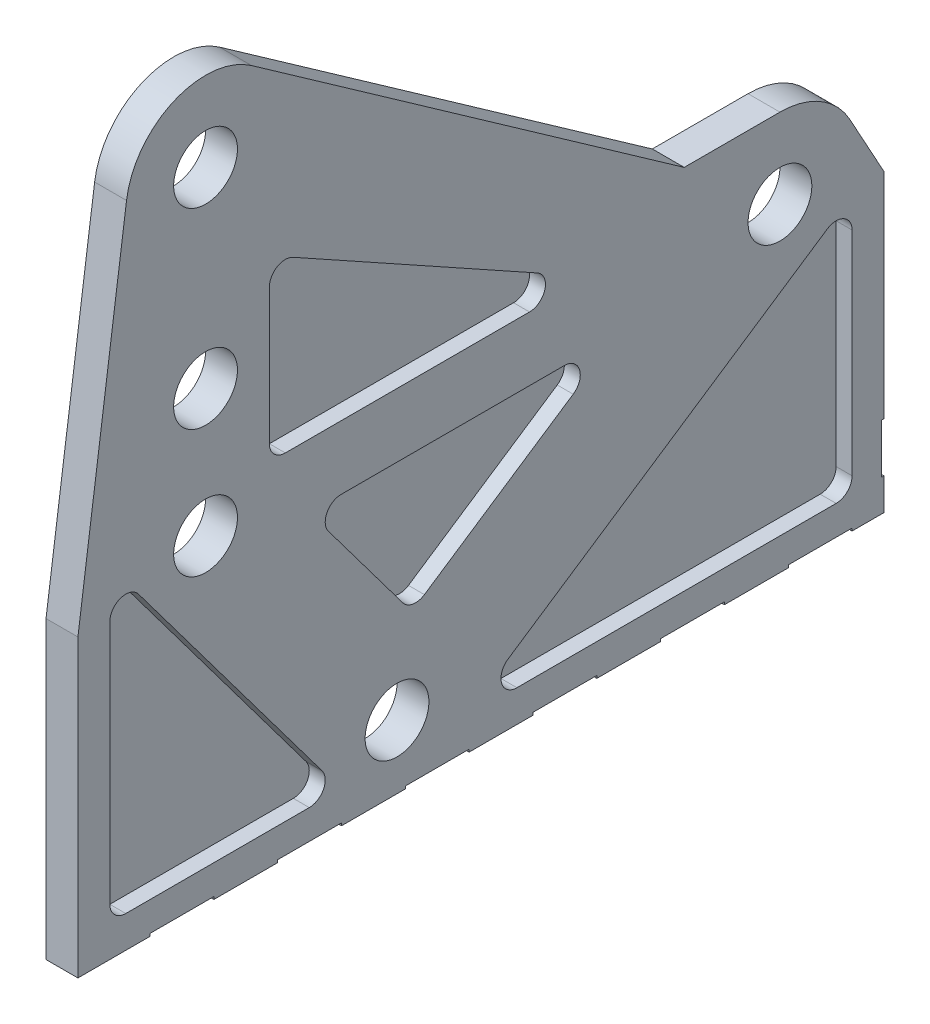
from build123d import *

# Parameters (mm, degrees)
SKETCH1_W           = 558.8
SKETCH1_H           = 88.9
BOSS_EXTRUDE1_DEPTH = 12.7
SKETCH2_R           = 12.7
BOSS_EXTRUDE2_DEPTH = 12.7
BOSS_EXTRUDE3_DEPTH = 12.7
CUT_EXTRUDE1_DEPTH  = 339.909706081
CUT_EXTRUDE2_DEPTH  = 339.909706081
SKETCH6_R           = 12.7
BOSS_EXTRUDE4_DEPTH = 12.7
SKETCH7_R           = 12.7
CUT_EXTRUDE3_DEPTH  = 351.575213043
CUT_EXTRUDE4_DEPTH  = 6.35
SKETCH9_W           = 25.4
SKETCH9_H           = 1.016
CUT_EXTRUDE5_DEPTH  = 351.575213043
SKETCH10_W          = 1.016
SKETCH10_H          = 19.685
CUT_EXTRUDE6_DEPTH  = 351.575213043


with BuildPart() as part:
    # Sketch1 → Boss-Extrude1 (new body)
    with BuildSketch(Plane(origin=(0, 0, 0), x_dir=(0, 0, -1), z_dir=(1, 0, 0))):
        Rectangle(SKETCH1_W, SKETCH1_H)
    extrude(amount=BOSS_EXTRUDE1_DEPTH)

    # Sketch2 → Boss-Extrude2 (add)
    with BuildSketch(Plane(origin=(12.7, 0, 0), x_dir=(0, 0, -1), z_dir=(1, 0, 0))):
        with BuildLine():
            Line((-226.959477075, 103.610620816), (-279.4, 44.45))
            Line((-279.4, 44.45), (82.55, 44.45))
            Line((82.55, 44.45), (53.228733422, 97.8347668))
            ThreePointArc((53.228733422, 97.8347668), (41.567423328, 109.875389713), (25.4, 114.3))
            Line((25.4, 114.3), (-203.2, 114.3))
            ThreePointArc((-203.2, 114.3), (-216.226660913, 111.504595584), (-226.959477075, 103.610620816))
        make_face()
        with Locations((-203.2, 82.55)):
            Circle(SKETCH2_R, mode=Mode.SUBTRACT)
        with Locations((25.4, 82.55)):
            Circle(SKETCH2_R, mode=Mode.SUBTRACT)
    extrude(amount=-BOSS_EXTRUDE2_DEPTH)

    # Sketch3 → Boss-Extrude3 (add)
    with BuildSketch(Plane(origin=(12.7, 0, 0), x_dir=(0, 0, -1), z_dir=(1, 0, 0))):
        Polygon((-279.4, -44.45), (-318.800892213, 0), (-279.4, 44.45), align=None)
    extrude(amount=-BOSS_EXTRUDE3_DEPTH)

    # Sketch4 → Cut-Extrude1 (cut, through all)
    with BuildSketch(Plane(origin=(12.7, 0, 0), x_dir=(0, 0, -1), z_dir=(1, 0, 0))):
        Polygon((82.55, 44.45), (106.963898899, 0), (82.55, -44.45), (279.4, -44.45), (279.4, 44.45), align=None)
    extrude(amount=-CUT_EXTRUDE1_DEPTH, mode=Mode.SUBTRACT)

    # Sketch5 → Cut-Extrude2 (cut, through all)
    with BuildSketch(Plane(origin=(12.7, 0, 0), x_dir=(0, 0, -1), z_dir=(1, 0, 0))):
        Polygon((-254, -44.45), (-254, 73.104934865), (-318.800892213, 0), (-279.4, -44.45), align=None)
        Polygon((66.811446957, 73.104934865), (66.811446957, -44.45), (82.55, -44.45), (106.963898899, 0), align=None)
    extrude(amount=-CUT_EXTRUDE2_DEPTH, mode=Mode.SUBTRACT)

    # Sketch6 → Boss-Extrude4 (add)
    with BuildSketch(Plane(origin=(12.7, 0, 0), x_dir=(0, 0, -1), z_dir=(1, 0, 0))):
        with BuildLine():
            Line((-234.654352451, 213.872755125), (-254, 73.104934865))
            Line((-254, 73.104934865), (-226.959477075, 103.610620816))
            ThreePointArc((-226.959477075, 103.610620816), (-216.226660913, 111.504595584), (-203.2, 114.3))
            Line((-203.2, 114.3), (-12.7, 114.3))
            Line((-12.7, 114.3), (-184.926288387, 235.514089892))
            ThreePointArc((-184.926288387, 235.514089892), (-215.869615853, 238.662597516), (-234.654352451, 213.872755125))
        make_face()
        with Locations((-203.2, 209.55)):
            Circle(SKETCH6_R, mode=Mode.SUBTRACT)
        with Locations((-203.2, 133.35)):
            Circle(SKETCH6_R, mode=Mode.SUBTRACT)
    extrude(amount=-BOSS_EXTRUDE4_DEPTH)

    # Sketch7 → Cut-Extrude3 (cut, through all)
    with BuildSketch(Plane(origin=(12.7, 0, 0), x_dir=(0, 0, -1), z_dir=(1, 0, 0))):
        with Locations((-127, -19.05)):
            Circle(SKETCH7_R)
    extrude(amount=-CUT_EXTRUDE3_DEPTH, mode=Mode.SUBTRACT)

    # Sketch8 → Cut-Extrude4 (cut)
    with BuildSketch(Plane(origin=(12.7, 0, 0), x_dir=(0, 0, -1), z_dir=(1, 0, 0))):
        with BuildLine():
            Line((-229.87, 75.776666667), (-156.845, -21.59))
            ThreePointArc((-156.845, -21.59), (-156.245387337, -28.239806331), (-161.925, -31.75))
            Line((-161.925, -31.75), (-234.95, -31.75))
            ThreePointArc((-234.95, -31.75), (-239.440128061, -29.890128061), (-241.3, -25.4))
            Line((-241.3, -25.4), (-241.3, 71.966666667))
            ThreePointArc((-241.3, 71.966666667), (-236.958046314, 77.990805609), (-229.87, 75.776666667))
        make_face()
        with BuildLine():
            Line((-82.809219748, -20.116480631), (44.239100711, 64.582399675))
            ThreePointArc((44.239100711, 64.582399675), (50.757744784, 64.897514008), (54.111446957, 59.298880306))
            Line((54.111446957, 59.298880306), (54.111446957, -25.4))
            ThreePointArc((54.111446957, -25.4), (52.251575018, -29.890128061), (47.761446957, -31.75))
            Line((47.761446957, -31.75), (-79.286873502, -31.75))
            ThreePointArc((-79.286873502, -31.75), (-85.36440787, -27.240129344), (-82.809219748, -20.116480631))
        make_face()
        with BuildLine():
            Line((-74.267251395, 95.25), (-171.45, 95.25))
            ThreePointArc((-171.45, 95.25), (-175.940128061, 97.109871939), (-177.8, 101.6))
            Line((-177.8, 101.6), (-177.8, 133.35))
            Line((-177.8, 133.35), (-177.8, 155.590415892))
            ThreePointArc((-177.8, 155.590415892), (-174.670261085, 161.06329617), (-168.366167387, 161.141314595))
            Line((-168.366167387, 161.141314595), (-71.183418782, 107.150898703))
            ThreePointArc((-71.183418782, 107.150898703), (-68.120272187, 100.007157692), (-74.267251395, 95.25))
        make_face()
        with BuildLine():
            Line((-154.305, 59.69), (-124.701042166, 20.218056221))
            ThreePointArc((-124.701042166, 20.218056221), (-120.693136442, 17.769213368), (-116.09869592, 18.744536852))
            Line((-116.09869592, 18.744536852), (-56.890780252, 58.216480631))
            ThreePointArc((-56.890780252, 58.216480631), (-54.33559213, 65.340129344), (-60.413126498, 69.85))
            Line((-60.413126498, 69.85), (-149.225, 69.85))
            ThreePointArc((-149.225, 69.85), (-154.904612663, 66.339806331), (-154.305, 59.69))
        make_face()
    extrude(amount=-CUT_EXTRUDE4_DEPTH, mode=Mode.SUBTRACT)

    # Sketch9 → Cut-Extrude5 (cut, through all)
    with BuildSketch(Plane(origin=(12.7, 0, 0), x_dir=(0, 0, -1), z_dir=(1, 0, 0))):
        with Locations((41.411446957, -43.942)):
            Rectangle(SKETCH9_W, SKETCH9_H)
        with Locations((-9.388553043, -43.942)):
            Rectangle(SKETCH9_W, SKETCH9_H)
        with Locations((-60.188553043, -43.942)):
            Rectangle(SKETCH9_W, SKETCH9_H)
        with Locations((-110.988553043, -43.942)):
            Rectangle(SKETCH9_W, SKETCH9_H)
        with Locations((-161.788553043, -43.942)):
            Rectangle(SKETCH9_W, SKETCH9_H)
        with Locations((-212.588553043, -43.942)):
            Rectangle(SKETCH9_W, SKETCH9_H)
    extrude(amount=-CUT_EXTRUDE5_DEPTH, mode=Mode.SUBTRACT)

    # Sketch10 → Cut-Extrude6 (cut, through all)
    with BuildSketch(Plane(origin=(12.7, 0, 0), x_dir=(0, 0, -1), z_dir=(1, 0, 0))):
        with Locations((66.303446957, -21.9075)):
            Rectangle(SKETCH10_W, SKETCH10_H)
    extrude(amount=-CUT_EXTRUDE6_DEPTH, mode=Mode.SUBTRACT)


solid = part.part
